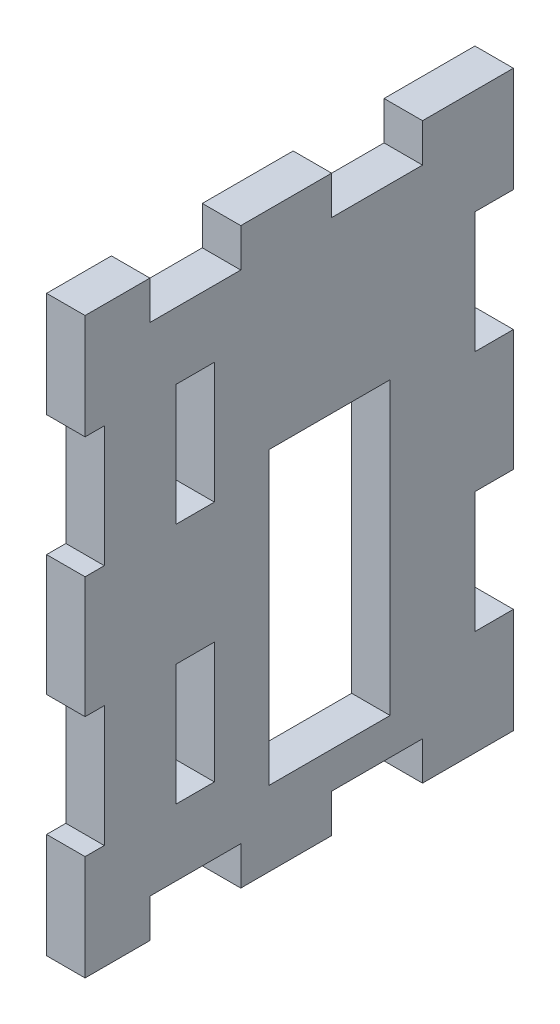
from build123d import *

# Parameters (mm, degrees)
SKETCH1_W           = 35.35
SKETCH1_H           = 47.35
SKETCH1_W_2         = 10
SKETCH1_H_2         = 24
BOSS_EXTRUDE1_DEPTH = 3.175
SKETCH2_W           = 3.175
SKETCH2_H           = 10
SKETCH2_W_2         = 1.5875
SKETCH2_W_3         = 7.5
SKETCH2_H_2         = 3.175
CUT_EXTRUDE1_DEPTH  = 60.175380227


with BuildPart() as part:
    # Sketch1 → Boss-Extrude1 (new body)
    with BuildSketch(Plane(origin=(0, 0, 0), x_dir=(0, 0, -1), z_dir=(1, 0, 0))):
        with Locations((17.675, 23.675)):
            Rectangle(SKETCH1_W, SKETCH1_H)
        with Locations((20.175, 18.175)):
            Rectangle(SKETCH1_W_2, SKETCH1_H_2, mode=Mode.SUBTRACT)
    extrude(amount=BOSS_EXTRUDE1_DEPTH)

    # Sketch2 → Cut-Extrude1 (cut, through all)
    with BuildSketch(Plane(origin=(3.175, 0, 0), x_dir=(0, 0, -1), z_dir=(1, 0, 0))):
        with Locations((33.7625, 33.675)):
            Rectangle(SKETCH2_W, SKETCH2_H)
        with Locations((33.7625, 13.675)):
            Rectangle(SKETCH2_W, SKETCH2_H)
        with Locations((9.0875, 13.675)):
            Rectangle(SKETCH2_W, SKETCH2_H)
        with Locations((9.0875, 33.675)):
            Rectangle(SKETCH2_W, SKETCH2_H)
        with Locations((0.79375, 33.675)):
            Rectangle(SKETCH2_W_2, SKETCH2_H)
        with Locations((0.79375, 13.675)):
            Rectangle(SKETCH2_W_2, SKETCH2_H)
        with Locations((24.1, 45.7625)):
            Rectangle(SKETCH2_W_3, SKETCH2_H_2)
        with Locations((9.1, 45.7625)):
            Rectangle(SKETCH2_W_3, SKETCH2_H_2)
        with Locations((9.1, 1.5875)):
            Rectangle(SKETCH2_W_3, SKETCH2_H_2)
        with Locations((24.1, 1.5875)):
            Rectangle(SKETCH2_W_3, SKETCH2_H_2)
    extrude(amount=-CUT_EXTRUDE1_DEPTH, mode=Mode.SUBTRACT)


solid = part.part
